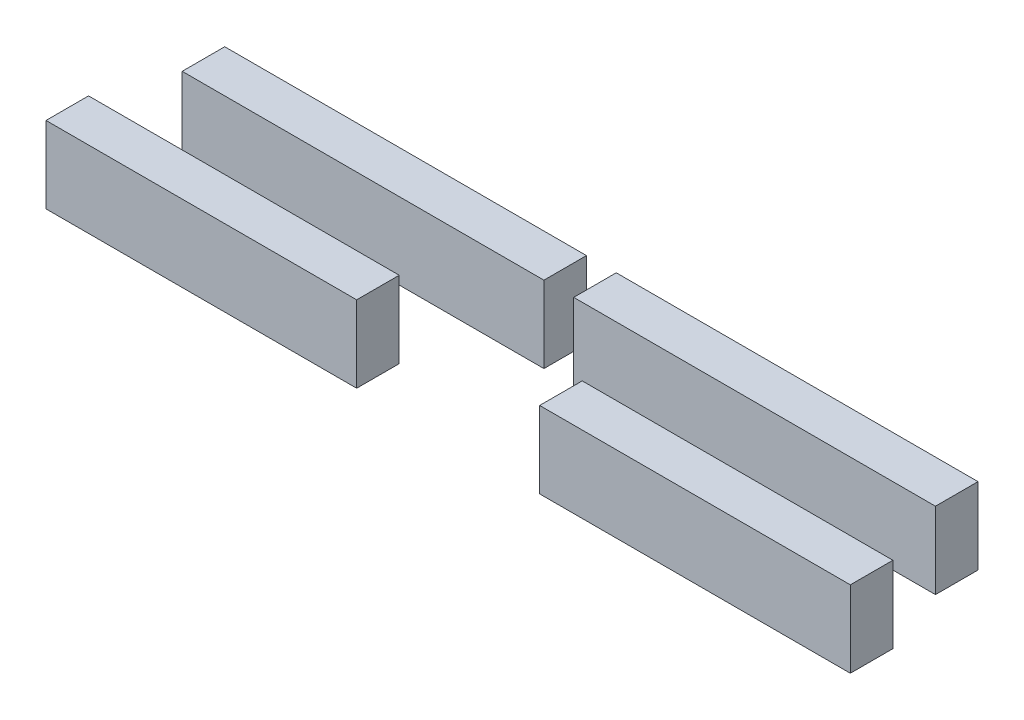
from build123d import *

# Parameters (mm, degrees)
SKETCH1_W             = 36.5
SKETCH1_H             = 5
BOSS_EXTRUDE1_DEPTH   = 9
BOSS_EXTRUDE1_2_DEPTH = 9
SKETCH1_W_2           = 42.5
BOSS_EXTRUDE1_3_DEPTH = 9
BOSS_EXTRUDE1_4_DEPTH = 9


with BuildPart() as part:
    # Sketch1 → Boss-Extrude1 (new body)
    with BuildSketch(Plane(origin=(0, 0, 0), x_dir=(1, 0, 0), z_dir=(0, 1, 0))):
        with Locations((79, 7)):
            Rectangle(SKETCH1_W, SKETCH1_H)
    extrude(amount=BOSS_EXTRUDE1_DEPTH)


with BuildPart() as body_2:
    # Sketch1 → Boss-Extrude1 2 (new body)
    with BuildSketch(Plane(origin=(0, 0, 0), x_dir=(1, 0, 0), z_dir=(0, 1, 0))):
        with Locations((21, 7)):
            Rectangle(SKETCH1_W, SKETCH1_H)
    extrude(amount=BOSS_EXTRUDE1_2_DEPTH)


with BuildPart() as body_3:
    # Sketch1 → Boss-Extrude1 3 (new body)
    with BuildSketch(Plane(origin=(0, 0, 0), x_dir=(1, 0, 0), z_dir=(0, 1, 0))):
        with Locations((73, 20)):
            Rectangle(SKETCH1_W_2, SKETCH1_H)
    extrude(amount=BOSS_EXTRUDE1_3_DEPTH)


with BuildPart() as body_4:
    # Sketch1 → Boss-Extrude1 4 (new body)
    with BuildSketch(Plane(origin=(0, 0, 0), x_dir=(1, 0, 0), z_dir=(0, 1, 0))):
        with Locations((27, 20)):
            Rectangle(SKETCH1_W_2, SKETCH1_H)
    extrude(amount=BOSS_EXTRUDE1_4_DEPTH)


solid = Compound([part.part, body_2.part, body_3.part, body_4.part])
